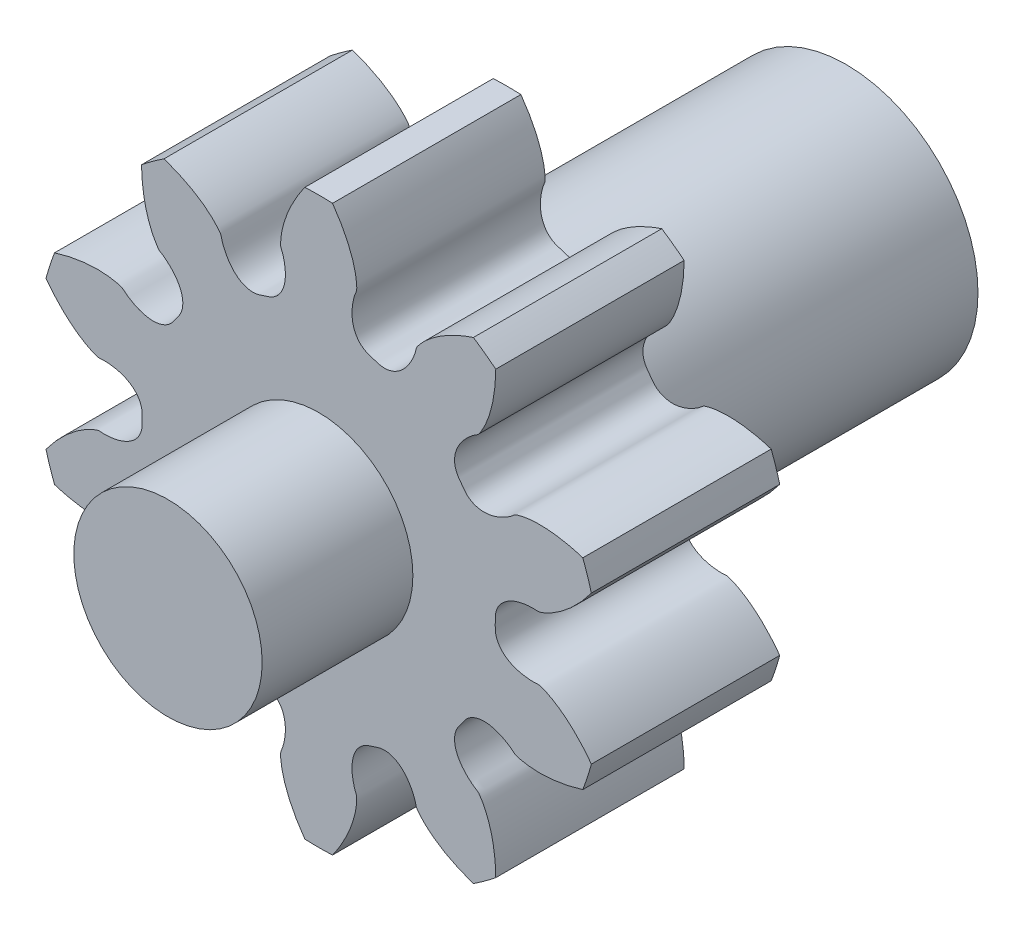
from build123d import *

# Parameters (mm, degrees)
SKETCHREVOLVESPURPINION_W       = 10
SKETCHREVOLVESPURPINION_H       = 15
TOOTHEXTRUDECUTSPURPINION_DEPTH = 5
PATTERNSPURPINION_COUNT         = 10
SKETCH3_R                       = 5
BOSS_EXTRUDE1_DEPTH             = 8
SKETCH4_R                       = 7
BOSS_EXTRUDE2_DEPTH             = 18
CUT_EXTRUDE2_DEPTH              = 15


with BuildPart() as part:
    # SketchRevolveSpurPinion → SpurPinion (revolve)
    with BuildSketch(Plane(origin=(0, 0, 0), x_dir=(0, 0, -1), z_dir=(1, 0, 0))):
        with Locations((0, 7.5)):
            Rectangle(SKETCHREVOLVESPURPINION_W, SKETCHREVOLVESPURPINION_H)
    revolve(axis=Axis((0, 0, 0), (0, 0, -1)))

    # SketchToothSpurPinion → ToothExtrudeCutSpurPinion (cut, symmetric)
    with BuildSketch(Plane.XY):
        with BuildLine():
            ThreePointArc((14.569567696, 4.061197133), (15.125, 0), (14.569567696, -4.061197133))
            add(Edge.make_bspline(
                [(14.569567696, -4.061197133), (14.427859874, -3.861632553), (14.209673665, -3.578045748), (13.904418686, -3.22876315), (13.684999286, -2.997332339), (13.470240269, -2.788455698), (13.261586972, -2.601352826), (13.060428263, -2.435163887), (12.868092511, -2.288952382), (12.685843528, -2.161712646), (12.514877767, -2.05236001), (12.356318142, -1.959778869), (12.211219584, -1.882685067), (12.080538286, -1.820076681), (11.965214456, -1.769860456), (11.842832435, -1.724424039), (11.649179793, -1.649342105), (11.434569911, -1.696941934), (11.239080863, -1.683850658), (11.11883073, -1.675708103), (11.001574361, -1.662620506), (10.887187648, -1.645922904), (10.775720498, -1.625282664), (10.667170857, -1.600776991), (10.561545218, -1.572348483), (10.458845742, -1.53994129), (10.359077942, -1.503459489), (10.262255057, -1.462771216), (10.16840608, -1.417700573), (10.077586537, -1.368023104), (9.989893335, -1.3134618), (9.905484435, -1.253686303), (9.824604013, -1.188317439), (9.747613068, -1.116940646), (9.675023698, -1.039132755), (9.607533684, -0.954507059), (9.546050385, -0.862780951), (9.49170341, -0.763865715), (9.445785092, -0.657974866), (9.409779592, -0.545719815), (9.384800939, -0.428213973), (9.374373909, -0.320691454), (9.370444082, -0.177657223), (9.378345923, 0), (9.370444082, 0.177657223), (9.374373909, 0.320691454), (9.384800939, 0.428213973), (9.409779592, 0.545719815), (9.445785092, 0.657974866), (9.49170341, 0.763865715), (9.546050385, 0.862780951), (9.607533684, 0.954507059), (9.675023698, 1.039132755), (9.747613068, 1.116940646), (9.824604013, 1.188317439), (9.905484435, 1.253686303), (9.989893335, 1.3134618), (10.077586537, 1.368023104), (10.16840608, 1.417700573), (10.262255057, 1.462771216), (10.359077942, 1.503459489), (10.458845742, 1.53994129), (10.561545218, 1.572348483), (10.667170857, 1.600776991), (10.775720498, 1.625282664), (10.887187648, 1.645922904), (11.001574361, 1.662620506), (11.11883073, 1.675708103), (11.239080863, 1.683850658), (11.434569911, 1.696941934), (11.649179793, 1.649342105), (11.842832435, 1.724424039), (11.965214456, 1.769860456), (12.080538286, 1.820076681), (12.211219584, 1.882685067), (12.356318142, 1.959778869), (12.514877767, 2.05236001), (12.685843528, 2.161712646), (12.868092511, 2.288952382), (13.060428263, 2.435163887), (13.261586972, 2.601352826), (13.470240269, 2.788455698), (13.684999286, 2.997332339), (13.904418686, 3.22876315), (14.209673665, 3.578045748), (14.427859874, 3.861632553), (14.569567696, 4.061197133)],
                knots=[0, 0, 0, 0, 0.05171016, 0.07552405, 0.097977146, 0.119069449, 0.138800958, 0.157171673, 0.174181594, 0.189830722, 0.204119057, 0.217046597, 0.228613344, 0.238819298, 0.247664458, 0.255148825, 0.266491119, 0.290788773, 0.29945532, 0.307936773, 0.316241042, 0.324377015, 0.332354693, 0.340185343, 0.347881664, 0.355457971, 0.362930389, 0.370317039, 0.377638219, 0.384916533, 0.392176948, 0.399446703, 0.406754997, 0.414132351, 0.421609511, 0.429215785, 0.43697672, 0.444911182, 0.453028093, 0.461323375, 0.469777943, 0.478357658, 0.484105593, 0.5, 0.515894407, 0.521642342, 0.530222057, 0.538676625, 0.546971907, 0.555088818, 0.56302328, 0.570784215, 0.578390489, 0.585867649, 0.593245003, 0.600553297, 0.607823052, 0.615083467, 0.622361781, 0.629682961, 0.637069611, 0.644542029, 0.652118336, 0.659814657, 0.667645307, 0.675622985, 0.683758958, 0.692063227, 0.70054468, 0.709211227, 0.733508881, 0.744851175, 0.752335542, 0.761180702, 0.771386656, 0.782953403, 0.795880943, 0.810169278, 0.825818406, 0.842828327, 0.861199042, 0.880930551, 0.902022854, 0.92447595, 0.94828984, 1, 1, 1, 1], degree=3))
        make_face()
    toothextrudecutspurpinion = extrude(amount=TOOTHEXTRUDECUTSPURPINION_DEPTH, both=True, mode=Mode.SUBTRACT)

    # PatternSpurPinion: ToothExtrudeCutSpurPinion ×10 about axis
    patternspurpinion_axis = Axis((0, 0, 55), (0, 0, -1))
    for i in range(1, PATTERNSPURPINION_COUNT):
        add(toothextrudecutspurpinion.rotate(patternspurpinion_axis, i * 360 / PATTERNSPURPINION_COUNT), mode=Mode.SUBTRACT)

    # Sketch3 → Boss-Extrude1 (add)
    with BuildSketch(Plane.XY.offset(5)):
        Circle(SKETCH3_R)
    extrude(amount=BOSS_EXTRUDE1_DEPTH)

    # Sketch4 → Boss-Extrude2 (add)
    with BuildSketch(Plane(origin=(0, 0, -5), x_dir=(-1, 0, 0), z_dir=(0, 0, -1))):
        Circle(SKETCH4_R)
    extrude(amount=BOSS_EXTRUDE2_DEPTH)

    # Sketch6 → Cut-Extrude2 (cut)
    with BuildSketch(Plane(origin=(0, 0, -23), x_dir=(-1, 0, 0), z_dir=(0, 0, -1))):
        with BuildLine():
            Line((-2.645751311, -3), (2.645751311, -3))
            ThreePointArc((2.645751311, -3), (0, 4), (-2.645751311, -3))
        make_face()
    extrude(amount=-CUT_EXTRUDE2_DEPTH, mode=Mode.SUBTRACT)


solid = part.part
